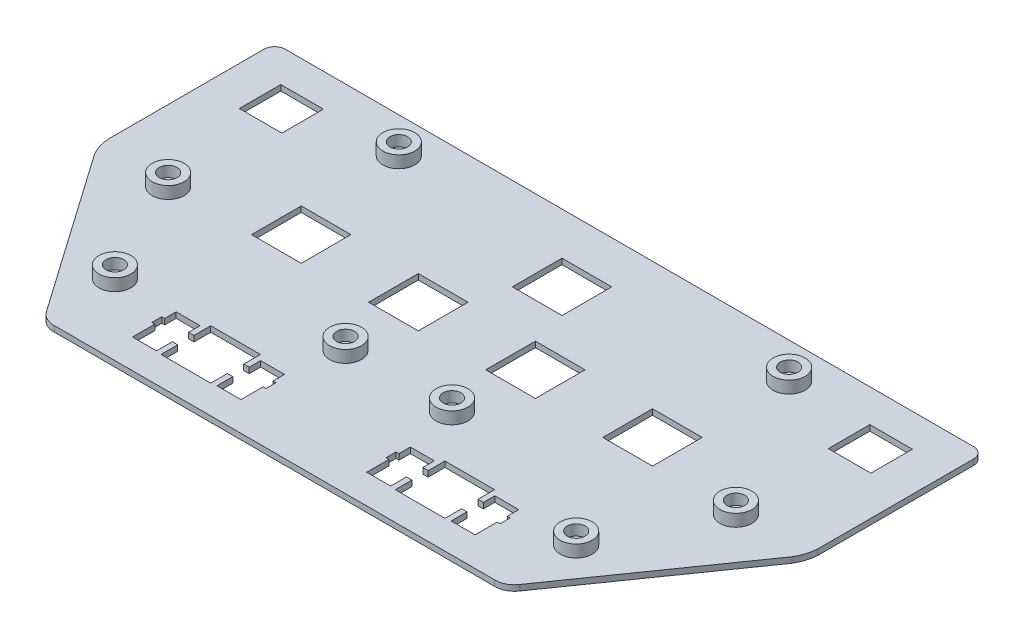
from build123d import *

# Parameters (mm, degrees)
SKETCH_1_W      = 14
SKETCH_1_H      = 14
SKETCH_1_W_2    = 12
SKETCH_1_H_2    = 11.7
EXTRUDE_1_DEPTH = 1.6
SKETCH_2_R      = 4.5
SKETCH_2_R_2    = 2.5
EXTRUDE_2_DEPTH = 5
SKETCH_3_R      = 2.5
EXTRUDE_3_DEPTH = 2


with BuildPart() as part:
    # 草图1 → 凸台-拉伸1 (new body)
    with BuildSketch(Plane(origin=(0, 0, 0), x_dir=(1, 0, 0), z_dir=(0, 1, 0))):
        with BuildLine():
            Line((197, 0), (3, 0))
            ThreePointArc((3, 0), (0.878679656, -0.878679656), (0, -3))
            Line((0, -3), (0, -47))
            ThreePointArc((0, -47), (0.538734236, -49.830178992), (1.720387033, -52.457695762))
            Line((1.720387033, -52.457695762), (33.279612967, -97.542304238))
            ThreePointArc((33.279612967, -97.542304238), (35.317699373, -99.389808931), (38, -100))
            Line((38, -100), (162, -100))
            ThreePointArc((162, -100), (164.682300627, -99.389808931), (166.720387033, -97.542304238))
            Line((166.720387033, -97.542304238), (198.279612967, -52.457695762))
            ThreePointArc((198.279612967, -52.457695762), (199.461265764, -49.830178992), (200, -47))
            Line((200, -47), (200, -3))
            ThreePointArc((200, -3), (199.121320344, -0.878679656), (197, 0))
        make_face()
        with Locations((100, -19)):
            Rectangle(SKETCH_1_W, SKETCH_1_H, mode=Mode.SUBTRACT)
        with Locations((83.5, -43)):
            Rectangle(SKETCH_1_W, SKETCH_1_H, mode=Mode.SUBTRACT)
        with Locations((116.5, -43)):
            Rectangle(SKETCH_1_W, SKETCH_1_H, mode=Mode.SUBTRACT)
        with Locations((50.5, -43)):
            Rectangle(SKETCH_1_W, SKETCH_1_H, mode=Mode.SUBTRACT)
        with Locations((149.5, -43)):
            Rectangle(SKETCH_1_W, SKETCH_1_H, mode=Mode.SUBTRACT)
        Polygon((60, -78), (74, -78), (74, -82.7), (75.525, -82.7), (75.525, -79.47), (82.275, -79.47), (82.275, -82.7), (83.1, -82.7), (83.1, -85.5), (82.275, -85.5), (82.275, -91.77), (75.525, -91.77), (75.525, -87.3), (74, -87.3), (74, -92), (60, -92), (60, -87.3), (58.475, -87.3), (58.475, -91.77), (51.725, -91.77), (51.725, -85.5), (50.9, -85.5), (50.9, -82.7), (51.725, -82.7), (51.725, -79.47), (58.475, -79.47), (58.475, -82.7), (60, -82.7), align=None, mode=Mode.SUBTRACT)
        Polygon((140, -78), (126, -78), (126, -82.7), (124.475, -82.7), (124.475, -79.47), (117.725, -79.47), (117.725, -82.7), (116.9, -82.7), (116.9, -85.5), (117.725, -85.5), (117.725, -91.77), (124.475, -91.77), (124.475, -87.3), (126, -87.3), (126, -92), (140, -92), (140, -87.3), (141.525, -87.3), (141.525, -91.77), (148.275, -91.77), (148.275, -85.5), (149.1, -85.5), (149.1, -82.7), (148.275, -82.7), (148.275, -79.47), (141.525, -79.47), (141.525, -82.7), (140, -82.7), align=None, mode=Mode.SUBTRACT)
        with Locations((17, -15.1)):
            Rectangle(SKETCH_1_W_2, SKETCH_1_H_2, mode=Mode.SUBTRACT)
        with Locations((183, -15.1)):
            Rectangle(SKETCH_1_W_2, SKETCH_1_H_2, mode=Mode.SUBTRACT)
    extrude(amount=EXTRUDE_1_DEPTH)

    # 草图2 → 凸台-拉伸2 (add)
    # profile 1 of 8: a face of its own
    with BuildSketch(Plane(origin=(0, 0, 0), x_dir=(1, 0, 0), z_dir=(0, 1, 0))):
        with Locations((35, -80)):
            Circle(SKETCH_2_R)
        with Locations((35, -80)):
            Circle(SKETCH_2_R_2, mode=Mode.SUBTRACT)
    # profile 2 of 8: a face of its own
    with BuildSketch(Plane(origin=(0, 0, 0), x_dir=(1, 0, 0), z_dir=(0, 1, 0))):
        with Locations((20, -50)):
            Circle(SKETCH_2_R)
        with Locations((20, -50)):
            Circle(SKETCH_2_R_2, mode=Mode.SUBTRACT)
    # profile 3 of 8: a face of its own
    with BuildSketch(Plane(origin=(0, 0, 0), x_dir=(1, 0, 0), z_dir=(0, 1, 0))):
        with Locations((45, -10)):
            Circle(SKETCH_2_R)
        with Locations((45, -10)):
            Circle(SKETCH_2_R_2, mode=Mode.SUBTRACT)
    # profile 4 of 8: a face of its own
    with BuildSketch(Plane(origin=(0, 0, 0), x_dir=(1, 0, 0), z_dir=(0, 1, 0))):
        with Locations((85, -65)):
            Circle(SKETCH_2_R)
        with Locations((85, -65)):
            Circle(SKETCH_2_R_2, mode=Mode.SUBTRACT)
    # profile 5 of 8: a face of its own
    with BuildSketch(Plane(origin=(0, 0, 0), x_dir=(1, 0, 0), z_dir=(0, 1, 0))):
        with Locations((115, -65)):
            Circle(SKETCH_2_R)
        with Locations((115, -65)):
            Circle(SKETCH_2_R_2, mode=Mode.SUBTRACT)
    # profile 6 of 8: a face of its own
    with BuildSketch(Plane(origin=(0, 0, 0), x_dir=(1, 0, 0), z_dir=(0, 1, 0))):
        with Locations((165, -80)):
            Circle(SKETCH_2_R)
        with Locations((165, -80)):
            Circle(SKETCH_2_R_2, mode=Mode.SUBTRACT)
    # profile 7 of 8: a face of its own
    with BuildSketch(Plane(origin=(0, 0, 0), x_dir=(1, 0, 0), z_dir=(0, 1, 0))):
        with Locations((155, -10)):
            Circle(SKETCH_2_R)
        with Locations((155, -10)):
            Circle(SKETCH_2_R_2, mode=Mode.SUBTRACT)
    # profile 8 of 8: a face of its own
    with BuildSketch(Plane(origin=(0, 0, 0), x_dir=(1, 0, 0), z_dir=(0, 1, 0))):
        with Locations((180, -50)):
            Circle(SKETCH_2_R)
        with Locations((180, -50)):
            Circle(SKETCH_2_R_2, mode=Mode.SUBTRACT)
    extrude(amount=EXTRUDE_2_DEPTH)

    # 草图3 → 凸台-拉伸3 (add)
    with BuildSketch(Plane(origin=(0, 0, 0), x_dir=(1, 0, 0), z_dir=(0, 1, 0))):
        with Locations((180, -50)):
            Circle(SKETCH_3_R)
        with Locations((165, -80)):
            Circle(SKETCH_3_R)
        with Locations((115, -65)):
            Circle(SKETCH_3_R)
        with Locations((155, -10)):
            Circle(SKETCH_3_R)
        with Locations((45, -10)):
            Circle(SKETCH_3_R)
        with Locations((20, -50)):
            Circle(SKETCH_3_R)
        with Locations((35, -80)):
            Circle(SKETCH_3_R)
        with Locations((85, -65)):
            Circle(SKETCH_3_R)
    extrude(amount=EXTRUDE_3_DEPTH)


solid = part.part
